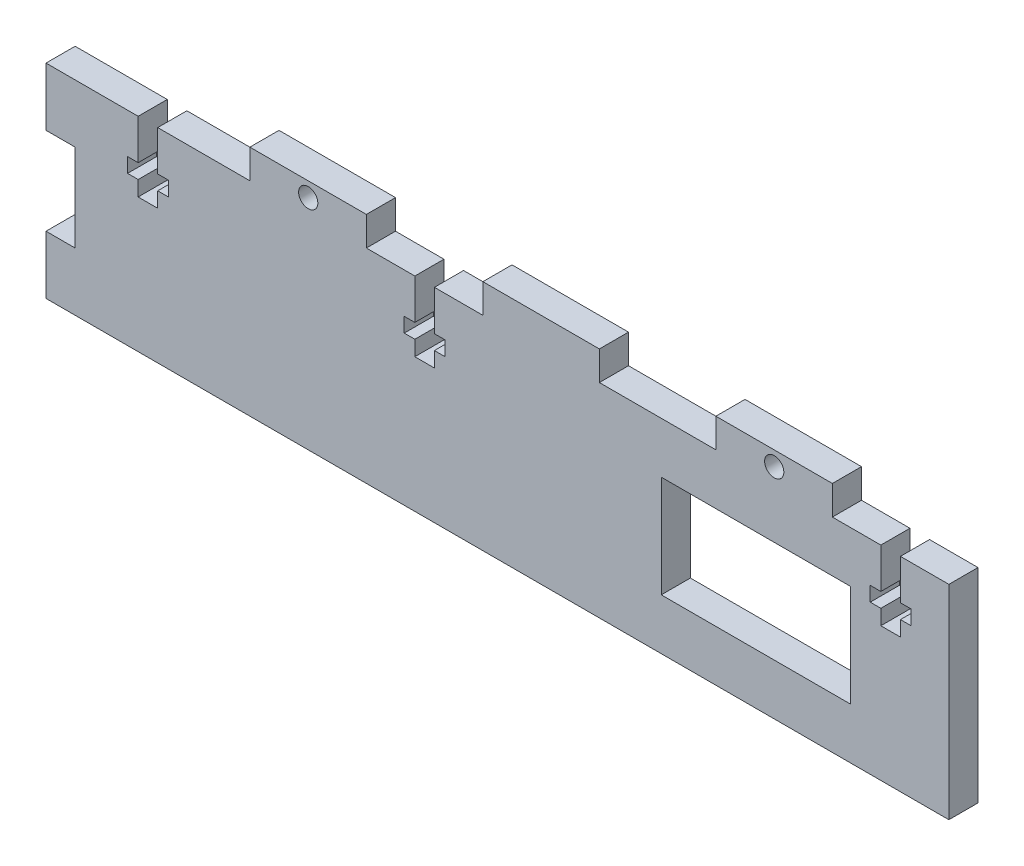
from build123d import *

# Parameters (mm, degrees)
SKETCH1_W           = 190.5
SKETCH1_H           = 44.45
BOSS_EXTRUDE1_DEPTH = 6.35
SKETCH2_W           = 41.275
SKETCH2_H           = 22.225
CUT_EXTRUDE1_DEPTH  = 151.221931202
SKETCH3_W           = 25.4
SKETCH3_H           = 6.35
BOSS_EXTRUDE2_DEPTH = 6.35
LPATTERN1_COUNT     = 3
LPATTERN1_PITCH     = 50.8
SKETCH4_W           = 6.35
SKETCH4_H           = 12.7
BOSS_EXTRUDE3_DEPTH = 6.35
LPATTERN2_COUNT     = 2
LPATTERN2_PITCH     = 31.75
CUT_EXTRUDE2_DEPTH  = 6.35
SKETCH6_R           = 2.0955
CUT_EXTRUDE3_DEPTH  = 158.526601607


with BuildPart() as part:
    # Sketch1 → Boss-Extrude1 (new body)
    with BuildSketch(Plane.XY):
        with Locations((-53.183, 0)):
            Rectangle(SKETCH1_W, SKETCH1_H)
    extrude(amount=BOSS_EXTRUDE1_DEPTH)

    # Sketch2 → Cut-Extrude1 (cut, through all)
    with BuildSketch(Plane.XY.offset(6.35)):
        Rectangle(SKETCH2_W, SKETCH2_H)
    extrude(amount=-CUT_EXTRUDE1_DEPTH, mode=Mode.SUBTRACT)

    # Sketch3 → Boss-Extrude2 (add)
    with BuildSketch(Plane(origin=(0, 22.225, 0), x_dir=(1, 0, 0), z_dir=(0, 1, 0))):
        with Locations((3.967, -3.175)):
            Rectangle(SKETCH3_W, SKETCH3_H)
    boss_extrude2 = extrude(amount=BOSS_EXTRUDE2_DEPTH)

    # LPattern1: Boss-Extrude2 ×3
    with Locations(*[(-i * LPATTERN1_PITCH, 0, 0) for i in range(1, LPATTERN1_COUNT)]):
        add(boss_extrude2)

    # Sketch4 → Boss-Extrude3 (add)
    with BuildSketch(Plane.ZY.offset(148.433)):
        with Locations((3.175, 15.875)):
            Rectangle(SKETCH4_W, SKETCH4_H)
    boss_extrude3 = extrude(amount=BOSS_EXTRUDE3_DEPTH)

    # LPattern2: Boss-Extrude3 ×2
    with Locations(*[(0, -i * LPATTERN2_PITCH, 0) for i in range(1, LPATTERN2_COUNT)]):
        add(boss_extrude3)

    # Sketch5 → Cut-Extrude2 (cut)
    with BuildSketch(Plane.XY.offset(6.35)):
        Polygon((31.5006, 22.225), (27.2334, 22.225), (27.2334, 13.462), (24.922, 13.462), (24.922, 10.287), (27.2334, 10.287), (27.2334, 6.985), (31.5006, 6.985), (31.5006, 10.287), (33.812, 10.287), (33.812, 13.462), (31.5006, 13.462), align=None)
        Polygon((-70.0994, 22.225), (-74.3666, 22.225), (-74.3666, 13.462), (-76.678, 13.462), (-76.678, 10.287), (-74.3666, 10.287), (-74.3666, 6.985), (-70.0994, 6.985), (-70.0994, 10.287), (-67.788, 10.287), (-67.788, 13.462), (-70.0994, 13.462), align=None)
        Polygon((-130.4244, 22.225), (-134.6916, 22.225), (-134.6916, 13.462), (-137.003, 13.462), (-137.003, 10.287), (-134.6916, 10.287), (-134.6916, 6.985), (-130.4244, 6.985), (-130.4244, 10.287), (-128.113, 10.287), (-128.113, 13.462), (-130.4244, 13.462), align=None)
    extrude(amount=-CUT_EXTRUDE2_DEPTH, mode=Mode.SUBTRACT)

    # Sketch6 → Cut-Extrude3 (cut, through all)
    with BuildSketch(Plane(origin=(0, 0, 0), x_dir=(-1, 0, 0), z_dir=(0, 0, -1))):
        with Locations((-3.98760291, 25.4)):
            Circle(SKETCH6_R)
        with Locations((97.61239709, 25.4)):
            Circle(SKETCH6_R)
    extrude(amount=-CUT_EXTRUDE3_DEPTH, mode=Mode.SUBTRACT)


solid = part.part
